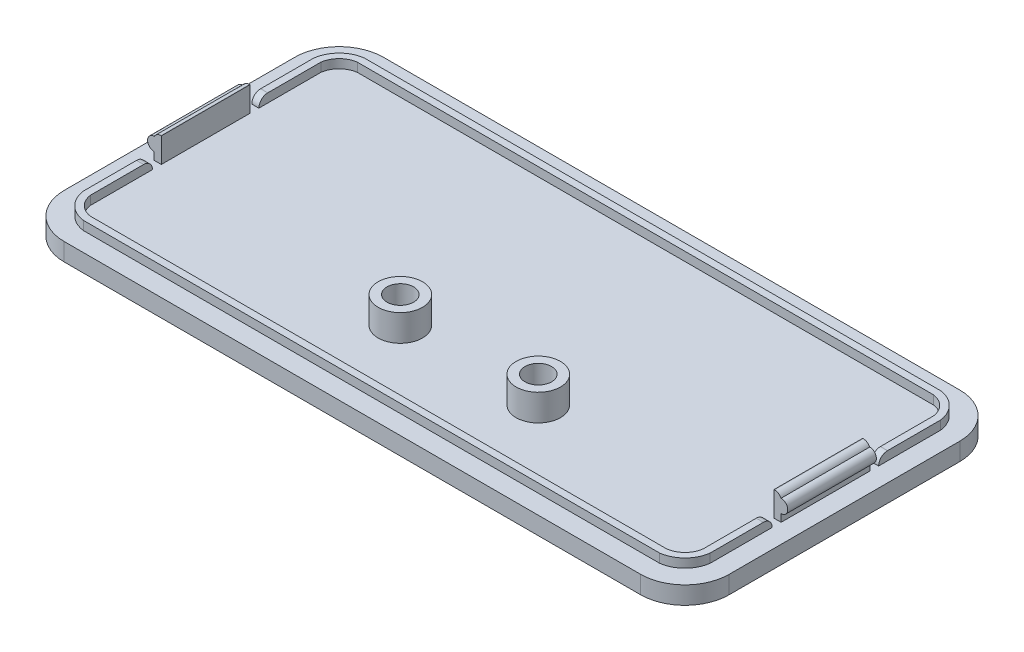
from build123d import *

# Parameters (mm, degrees)
EXTRUDE_2_DEPTH     = 2
EXTRUDE_4_DEPTH     = 1
SKETCH_7_W          = 0.8
SKETCH_7_H          = 10
EXTRUDE_8_DEPTH     = 2.8
SKETCH_8_R          = 0.75
EXTRUDE_9_DEPTH     = 10
FILLET_1_R          = 0.85
SKETCH_11_W         = 1
SKETCH_11_H         = 1
CUT_EXTRUDE_1_DEPTH = 1.2
FILLET_2_R          = 1
SKETCH3_W           = 1.794871795
SKETCH3_H           = 10.256410256
CUT_EXTRUDE1_DEPTH  = 1
SKETCH_13_W         = 0.8
SKETCH_13_H         = 10
EXTRUDE_10_DEPTH    = 1.8
SKETCH_14_R         = 0.75
EXTRUDE_11_DEPTH    = 10
FILLET_3_R          = 0.85
SKETCH_15_W         = 0.8
SKETCH_15_H         = 1
CUT_EXTRUDE_3_DEPTH = 1
FILLET_4_R          = 1
SKETCH2_R           = 2.5
SKETCH2_R_2         = 1.5
BOSS_EXTRUDE1_DEPTH = 3


# Some blends are built 0.0001 mm under size
with BuildPart() as part:
    # case 2 → 凸台-拉伸2 (new body)
    with BuildSketch(Plane(origin=(0, 0, 0), x_dir=(1, 0, 0), z_dir=(0, 1, 0))):
        with BuildLine():
            Line((-34.042196447, 18), (30.957803553, 18))
            ThreePointArc((30.957803553, 18), (34.493337459, 16.535533906), (35.957803553, 13))
            Line((35.957803553, 13), (35.957803553, -13))
            ThreePointArc((35.957803553, -13), (34.493337459, -16.535533906), (30.957803553, -18))
            Line((30.957803553, -18), (-34.042196447, -18))
            ThreePointArc((-34.042196447, -18), (-37.577730353, -16.535533906), (-39.042196447, -13))
            Line((-39.042196447, -13), (-39.042196447, 13))
            ThreePointArc((-39.042196447, 13), (-37.577730353, 16.535533906), (-34.042196447, 18))
        make_face()
    extrude(amount=EXTRUDE_2_DEPTH)

    # 草图3 → 凸台-拉伸4 (add)
    with BuildSketch(Plane(origin=(0, 2, 0), x_dir=(1, 0, 0), z_dir=(0, 1, 0))):
        with BuildLine():
            Line((-36.892196447, 13), (-36.892196447, -13))
            ThreePointArc((-36.892196447, -13), (-35.952846076, -14.910649629), (-34.042196447, -15.85))
            Line((-34.042196447, -15.85), (30.957803553, -15.85))
            ThreePointArc((30.957803553, -15.85), (32.868453181, -14.910649629), (33.807803553, -13))
            Line((33.807803553, -13), (33.807803553, 13))
            ThreePointArc((33.807803553, 13), (32.868453181, 14.910649629), (30.957803553, 15.85))
            Line((30.957803553, 15.85), (-34.042196447, 15.85))
            ThreePointArc((-34.042196447, 15.85), (-35.952846076, 14.910649629), (-36.892196447, 13))
        make_face()
        with BuildLine():
            Line((-34.042196447, -15.05), (30.957803553, -15.05))
            ThreePointArc((30.957803553, -15.05), (32.327315928, -14.369512375), (33.007803553, -13))
            Line((33.007803553, -13), (33.007803553, 13))
            ThreePointArc((33.007803553, 13), (32.327315928, 14.369512375), (30.957803553, 15.05))
            Line((30.957803553, 15.05), (-34.042196447, 15.05))
            ThreePointArc((-34.042196447, 15.05), (-35.411708823, 14.369512375), (-36.092196447, 13))
            Line((-36.092196447, 13), (-36.092196447, -13))
            ThreePointArc((-36.092196447, -13), (-35.411708823, -14.369512375), (-34.042196447, -15.05))
        make_face(mode=Mode.SUBTRACT)
    extrude(amount=EXTRUDE_4_DEPTH)

    # 草图7 → 凸台-拉伸8 (add)
    with BuildSketch(Plane(origin=(0, 2, 0), x_dir=(1, 0, 0), z_dir=(0, 1, 0))):
        with Locations((-36.492196447, 0)):
            Rectangle(SKETCH_7_W, SKETCH_7_H)
    extrude(amount=EXTRUDE_8_DEPTH)

    # 草图8 → 凸台-拉伸9 (add)
    with BuildSketch(Plane.XY.offset(5)):
        with Locations((-36.892196447, 3.6)):
            Circle(SKETCH_8_R)
    extrude(amount=-EXTRUDE_9_DEPTH)

    # 圆角1
    # the kernel refuses this fillet: 0.85 mm, written as the material it takes off along each edge
    with BuildSketch(Plane(origin=(-36.892196447, 4.8, 6.875), x_dir=(0, -1, 0), z_dir=(0, 0, -1))) as fillet_1_piece_1:
        with BuildLine():
            CenterArc((0.85, -0.75), FILLET_1_R, 118.072486936, 61.927513064)
            Line((0, -0.75), (-0.017, -0.75))
            Line((-0.017, -0.75), (-0.017, 0))
            Line((-0.017, 0), (0, 0.017))
            ThreePointArc((0, 0.017), (0.225, 0.017), (0.442, 0.015))
            Line((0.442, 0.015), (0.45, 0))
        make_face()
    extrude(amount=13.75, mode=Mode.SUBTRACT)

    # 草图11 → 切除-拉伸1 (cut)
    with BuildSketch(Plane.ZY.offset(36.892196447)):
        with Locations((5.5, 2.5)):
            Rectangle(SKETCH_11_W, SKETCH_11_H)
        with Locations((-5.5, 2.5)):
            Rectangle(SKETCH_11_W, SKETCH_11_H)
    extrude(amount=-CUT_EXTRUDE_1_DEPTH, mode=Mode.SUBTRACT)

    # 圆角2
    fillet_2_edges = [part.edges().sort_by_distance(p)[0] for p in [
        (-36.492196447, 3, 6),
        (-36.492196447, 3, -6),
    ]]
    fillet(fillet_2_edges, radius=FILLET_2_R - 0.0001)  # a hair under: the kernel refuses the full size

    # Sketch3 → Cut-Extrude1 (cut)
    # profile 1 of 9: a face of its own
    with BuildSketch(Plane.XZ):
        with BuildLine():
            Line((-34.346153846, 5.5), (-32.342948718, 5.5))
            add(Edge.make_bspline(
                [(-32.342948718, 5.5), (-32.212061894, 5.499414123), (-31.959553774, 5.498283843), (-31.59541629, 5.484577693), (-31.259481633, 5.460015438), (-30.951826982, 5.429660375), (-30.672578836, 5.387103759), (-30.421387495, 5.33831593), (-30.198200829, 5.278878154), (-30.000502078, 5.208326339), (-29.823073834, 5.125148505), (-29.65516949, 5.036558175), (-29.500583701, 4.93082874), (-29.351514057, 4.81935527), (-29.216483126, 4.691488748), (-29.08706687, 4.555738875), (-28.96874642, 4.406721924), (-28.860973524, 4.246241705), (-28.7632069, 4.077263206), (-28.677791437, 3.899484343), (-28.608507197, 3.7126238), (-28.550386335, 3.517890353), (-28.503703092, 3.315292488), (-28.47262924, 3.10358421), (-28.451522316, 2.884243747), (-28.449659922, 2.73496049), (-28.448717949, 2.659455128)],
                knots=[0, 0, 0, 0, 1.698747864, 3.27724071, 4.728299578, 6.070144658, 7.288476769, 8.393259625, 9.389771311, 10.283485332, 11.113357557, 11.931608583, 12.74405601, 13.541433047, 14.344816069, 15.154114104, 15.974336324, 16.810834471, 17.661136416, 18.50621059, 19.367396281, 20.244825668, 21.142564693, 22.063065223, 23.020325768, 24, 24, 24, 24], degree=3))
            add(Edge.make_bspline(
                [(-28.448717949, 2.659455128), (-28.450080866, 2.575925345), (-28.452759164, 2.411779055), (-28.479015125, 2.171160733), (-28.523868602, 1.941752949), (-28.58248975, 1.721621064), (-28.664232772, 1.514386738), (-28.757620336, 1.315105294), (-28.872516661, 1.129363974), (-29.003804081, 0.954839376), (-29.147184921, 0.790112534), (-29.306063036, 0.639939624), (-29.477410142, 0.503296922), (-29.660234371, 0.378752402), (-29.8552221, 0.266557297), (-30.062232636, 0.165661021), (-30.282679565, 0.079290548), (-30.436192173, 0.03411949), (-30.514022436, 0.011217949)],
                knots=[0, 0, 0, 0, 1.102006807, 2.165578795, 3.188629044, 4.184801286, 5.166646146, 6.124351954, 7.085497154, 8.042432466, 9.003981491, 9.963833307, 10.922997304, 11.89326795, 12.880200226, 13.889073926, 14.929769137, 16, 16, 16, 16], degree=3))
            add(Edge.make_bspline(
                [(-30.514022436, 0.011217949), (-30.565285924, -0.00153649), (-30.676339148, -0.029166712), (-30.86010173, -0.057218322), (-31.071868812, -0.083010053), (-31.312325176, -0.105174923), (-31.581609449, -0.12024187), (-31.879460895, -0.132008485), (-32.206014495, -0.14056403), (-32.433086955, -0.140867618), (-32.551282051, -0.141025641)],
                knots=[0, 0, 0, 0, 0.618981996, 1.340914327, 2.176866532, 3.120127938, 4.170906482, 5.338178032, 6.614476169, 8, 8, 8, 8], degree=3))
            Line((-32.551282051, -0.141025641), (-32.551282051, -4.5))
            Line((-32.551282051, -4.5), (-34.346153846, -4.5))
            Line((-34.346153846, -4.5), (-34.346153846, 5.5))
        make_face()
        with BuildLine():
            Line((-32.551282051, 1.653846154), (-31.916266026, 1.653846154))
            add(Edge.make_bspline(
                [(-31.916266026, 1.653846154), (-31.800714834, 1.654578838), (-31.588098926, 1.655926988), (-31.297740676, 1.675422019), (-31.064403201, 1.705194869), (-30.880062263, 1.747896022), (-30.734507633, 1.812700675), (-30.608975876, 1.887667455), (-30.501304084, 1.982460891), (-30.40807616, 2.090778611), (-30.333543244, 2.215241101), (-30.281858549, 2.353821729), (-30.248285187, 2.50360877), (-30.245184375, 2.607850636), (-30.243589744, 2.661458333)],
                knots=[0, 0, 0, 0, 1.8619151, 3.425951444, 4.686033666, 5.651700536, 6.461346321, 7.243864085, 7.999046032, 8.762387399, 9.539336099, 10.322741239, 11.137448474, 12, 12, 12, 12], degree=3))
            add(Edge.make_bspline(
                [(-30.243589744, 2.661458333), (-30.245167972, 2.708294681), (-30.248230115, 2.799168456), (-30.270725453, 2.930321853), (-30.306576549, 3.052583875), (-30.35852341, 3.164677657), (-30.425678401, 3.266412733), (-30.507553924, 3.357749027), (-30.603099357, 3.440642582), (-30.676866017, 3.484519408), (-30.714342949, 3.506810897)],
                knots=[0, 0, 0, 0, 1.102301479, 2.1387299, 3.123554645, 4.094223062, 5.036071848, 5.982632524, 6.975082478, 8, 8, 8, 8], degree=3))
            add(Edge.make_bspline(
                [(-30.714342949, 3.506810897), (-30.746088073, 3.522865317), (-30.813299006, 3.556855813), (-30.927765742, 3.59637225), (-31.059858607, 3.629708718), (-31.210469377, 3.657377665), (-31.378997222, 3.678851641), (-31.565412075, 3.69527386), (-31.769988262, 3.701877875), (-31.912258759, 3.704014878), (-31.986378205, 3.705128205)],
                knots=[0, 0, 0, 0, 0.656809284, 1.390599849, 2.23162475, 3.173112763, 4.218524733, 5.370385145, 6.63003504, 8, 8, 8, 8], degree=3))
            Line((-31.986378205, 3.705128205), (-32.551282051, 3.705128205))
            Line((-32.551282051, 3.705128205), (-32.551282051, 1.653846154))
        make_face(mode=Mode.SUBTRACT)
    # profile 2 of 9: a face of its own
    with BuildSketch(Plane.XZ):
        with BuildLine():
            Line((-19.608573718, -1.294871795), (-25.371794872, -1.294871795))
            add(Edge.make_bspline(
                [(-25.371794872, -1.294871795), (-25.360044129, -1.361837155), (-25.336952993, -1.493429371), (-25.28680977, -1.684578484), (-25.222819497, -1.864714181), (-25.146131184, -2.03407726), (-25.058037797, -2.193563078), (-24.955284158, -2.342423583), (-24.839173605, -2.480527291), (-24.710377458, -2.60727399), (-24.571042515, -2.72084178), (-24.421844499, -2.820334343), (-24.262629446, -2.901912158), (-24.095222698, -2.970673791), (-23.91837334, -3.025139971), (-23.731821096, -3.062704259), (-23.536060486, -3.084893621), (-23.402702378, -3.088103059), (-23.334535256, -3.08974359)],
                knots=[0, 0, 0, 0, 1.091296461, 2.144483647, 3.168565212, 4.157007626, 5.126487748, 6.090021542, 7.05641414, 8.019231907, 8.98705074, 9.938580405, 10.892824166, 11.854447369, 12.841318655, 13.858982407, 14.905600794, 16, 16, 16, 16], degree=3))
            add(Edge.make_bspline(
                [(-23.334535256, -3.08974359), (-23.252252913, -3.087571256), (-23.090214747, -3.083293292), (-22.852827627, -3.045354104), (-22.623239702, -2.988048629), (-22.403623683, -2.902830576), (-22.191435664, -2.796749081), (-21.99016891, -2.664584591), (-21.796339653, -2.510199384), (-21.678080964, -2.391199325), (-21.617788462, -2.330528846)],
                knots=[0, 0, 0, 0, 1.021034703, 2.010718019, 2.977989445, 3.954245119, 4.929443971, 5.918328161, 6.938689359, 8, 8, 8, 8], degree=3))
            Line((-21.617788462, -2.330528846), (-20.115384615, -3.045673077))
            add(Edge.make_bspline(
                [(-20.115384615, -3.045673077), (-20.162686924, -3.111037607), (-20.256414708, -3.24055502), (-20.40942217, -3.42281947), (-20.5690952, -3.592879596), (-20.735552881, -3.749616887), (-20.909006324, -3.892584703), (-21.088973023, -4.02352465), (-21.278083117, -4.138921045), (-21.472555384, -4.244356693), (-21.676409927, -4.334746186), (-21.889082589, -4.411827154), (-22.109672582, -4.481507694), (-22.340965482, -4.534600448), (-22.581035315, -4.576628239), (-22.830456374, -4.606473539), (-23.089195787, -4.62490755), (-23.265059458, -4.62709288), (-23.354567308, -4.628205128)],
                knots=[0, 0, 0, 0, 1.028154879, 2.037251081, 3.030720504, 4.000128189, 4.949298328, 5.894184978, 6.834267904, 7.770992897, 8.712077017, 9.673380525, 10.653304757, 11.658697181, 12.695551717, 13.758623199, 14.859225354, 16, 16, 16, 16], degree=3))
            add(Edge.make_bspline(
                [(-23.354567308, -4.628205128), (-23.492273665, -4.62539771), (-23.761963628, -4.619899543), (-24.156433952, -4.568868685), (-24.531071349, -4.484254021), (-24.886933665, -4.369233381), (-25.222482625, -4.217370103), (-25.537884295, -4.031628717), (-25.836289987, -3.815570256), (-26.108581741, -3.564660229), (-26.356647563, -3.291559581), (-26.574533157, -2.998268135), (-26.75685672, -2.686835006), (-26.906584497, -2.359321324), (-27.022958126, -2.014888783), (-27.106856762, -1.653387079), (-27.158287632, -1.274988873), (-27.163842421, -1.017257454), (-27.166666667, -0.886217949)],
                knots=[0, 0, 0, 0, 1.103565453, 2.161269334, 3.182010356, 4.179077853, 5.15417608, 6.128274628, 7.109042802, 8.101804412, 9.090965879, 10.063106201, 11.02526161, 11.978650795, 12.945248442, 13.93468508, 14.949922959, 16, 16, 16, 16], degree=3))
            add(Edge.make_bspline(
                [(-27.166666667, -0.886217949), (-27.163814625, -0.751848561), (-27.15820336, -0.487482826), (-27.107299582, -0.100347232), (-27.022726175, 0.269032487), (-26.906012127, 0.621165006), (-26.75855574, 0.957151645), (-26.573912422, 1.274052922), (-26.356755688, 1.572972117), (-26.109583518, 1.852510854), (-25.836138252, 2.104825104), (-25.545576822, 2.329687524), (-25.234634472, 2.517057818), (-24.90682823, 2.668452899), (-24.564254861, 2.791457581), (-24.202954696, 2.873306924), (-23.82567668, 2.928263858), (-23.567777735, 2.933325049), (-23.436698718, 2.935897436)],
                knots=[0, 0, 0, 0, 1.079208495, 2.12329425, 3.130605359, 4.119693003, 5.099659317, 6.073216462, 7.060498243, 8.06384408, 9.066070512, 10.045757761, 11.010926815, 11.975797609, 12.942977511, 13.929384301, 14.947594487, 16, 16, 16, 16], degree=3))
            add(Edge.make_bspline(
                [(-23.436698718, 2.935897436), (-23.298332654, 2.933046463), (-23.026665148, 2.92744887), (-22.62944746, 2.876832371), (-22.252322515, 2.791701737), (-21.893683551, 2.677675659), (-21.558110534, 2.521976156), (-21.238229907, 2.34080557), (-20.941714222, 2.120076842), (-20.665402937, 1.870394688), (-20.415975531, 1.593380991), (-20.197948342, 1.292459272), (-20.012434038, 0.970566352), (-19.862072854, 0.626396885), (-19.745818719, 0.260984102), (-19.661842419, -0.125197436), (-19.610803845, -0.533616578), (-19.605352417, -0.813284573), (-19.602564103, -0.956330128)],
                knots=[0, 0, 0, 0, 1.080001299, 2.120471247, 3.119684163, 4.095710327, 5.052285597, 6.002875087, 6.961153713, 7.931888285, 8.906493152, 9.865905668, 10.82813294, 11.801621613, 12.7925306, 13.817193356, 14.883530496, 16, 16, 16, 16], degree=3))
            Line((-19.602564103, -0.956330128), (-19.608573718, -1.294871795))
        make_face()
        with BuildLine():
            add(Edge.make_bspline(
                [(-21.397435897, 0.115384615), (-21.431306226, 0.206786912), (-21.498649262, 0.388518488), (-21.650774379, 0.639263719), (-21.852639541, 0.856419274), (-22.087423207, 1.048668808), (-22.355678245, 1.204710539), (-22.648951472, 1.31768982), (-22.963535969, 1.385433614), (-23.179953151, 1.393378771), (-23.290464744, 1.397435897)],
                knots=[0, 0, 0, 0, 0.954238005, 1.897273737, 2.851915805, 3.847685534, 4.862635127, 5.880135777, 6.917509367, 8, 8, 8, 8], degree=3))
            add(Edge.make_bspline(
                [(-23.290464744, 1.397435897), (-23.411161396, 1.393538533), (-23.64709822, 1.385919998), (-23.987421025, 1.304894075), (-24.308439011, 1.183965305), (-24.497693022, 1.059285175), (-24.592548077, 0.996794872)],
                knots=[0, 0, 0, 0, 1.044195649, 2.041185066, 3.018232172, 4, 4, 4, 4], degree=3))
            add(Edge.make_bspline(
                [(-24.592548077, 0.996794872), (-24.651730547, 0.949200888), (-24.777904548, 0.847732947), (-24.941767086, 0.645314038), (-25.10317305, 0.40023018), (-25.19494124, 0.214071675), (-25.243589744, 0.115384615)],
                knots=[0, 0, 0, 0, 0.82159062, 1.751589201, 2.808063854, 4, 4, 4, 4], degree=3))
            Line((-25.243589744, 0.115384615), (-21.397435897, 0.115384615))
        make_face(mode=Mode.SUBTRACT)
    # profile 3 of 9: a face of its own
    with BuildSketch(Plane.XZ):
        with BuildLine():
            Line((-12.551282051, 2.807692308), (-10.756410256, 2.807692308))
            Line((-10.756410256, 2.807692308), (-10.756410256, -4.5))
            Line((-10.756410256, -4.5), (-12.551282051, -4.5))
            Line((-12.551282051, -4.5), (-12.551282051, -3.702724359))
            add(Edge.make_bspline(
                [(-12.551282051, -3.702724359), (-12.640217287, -3.780330319), (-12.812823018, -3.930948161), (-13.084793797, -4.12637864), (-13.357559306, -4.287583528), (-13.632430191, -4.41597443), (-13.913631102, -4.510777897), (-14.203186573, -4.579417821), (-14.50526651, -4.619896463), (-14.71061629, -4.625406724), (-14.814903846, -4.628205128)],
                knots=[0, 0, 0, 0, 1.129196829, 2.191548051, 3.199897424, 4.157751732, 5.089409408, 6.034969131, 7.002052659, 8, 8, 8, 8], degree=3))
            add(Edge.make_bspline(
                [(-14.814903846, -4.628205128), (-14.931971264, -4.625571477), (-15.163303116, -4.620367234), (-15.502756926, -4.565584179), (-15.830533327, -4.481726502), (-16.146366257, -4.363057407), (-16.449681084, -4.209285525), (-16.742799088, -4.024422978), (-17.020695333, -3.801979986), (-17.28568321, -3.55158109), (-17.528304521, -3.276140523), (-17.740406361, -2.979481362), (-17.919192449, -2.665811062), (-18.065662324, -2.336169585), (-18.180879796, -1.990798869), (-18.263013366, -1.628603503), (-18.311472267, -1.24945413), (-18.317470113, -0.991192425), (-18.320512821, -0.860176282)],
                knots=[0, 0, 0, 0, 0.980476535, 1.937477201, 2.874147792, 3.812856188, 4.758993464, 5.720109578, 6.712210464, 7.737600662, 8.772720504, 9.783789959, 10.789002326, 11.793715968, 12.802552247, 13.835794126, 14.902098527, 16, 16, 16, 16], degree=3))
            add(Edge.make_bspline(
                [(-18.320512821, -0.860176282), (-18.317319488, -0.724508894), (-18.311055411, -0.458382195), (-18.265234059, -0.067853919), (-18.184616162, 0.303322052), (-18.074687865, 0.655659847), (-17.933284198, 0.989220339), (-17.761063981, 1.304550006), (-17.555684317, 1.600824627), (-17.319020664, 1.8730014), (-17.063482045, 2.122464558), (-16.790100899, 2.339642021), (-16.503152308, 2.524144381), (-16.202331338, 2.674769906), (-15.88768095, 2.791165689), (-15.560443377, 2.87626051), (-15.219165916, 2.927320392), (-14.986684944, 2.933014678), (-14.868990385, 2.935897436)],
                knots=[0, 0, 0, 0, 1.136281865, 2.228943489, 3.287578264, 4.313574083, 5.316051562, 6.317280042, 7.318008486, 8.329309503, 9.333984563, 10.305318864, 11.248632312, 12.186624717, 13.117503092, 14.05354244, 15.014596925, 16, 16, 16, 16], degree=3))
            add(Edge.make_bspline(
                [(-14.868990385, 2.935897436), (-14.759967087, 2.933632454), (-14.544249279, 2.929150872), (-14.227175182, 2.880489461), (-13.919659039, 2.806892533), (-13.623378367, 2.702030158), (-13.335902973, 2.569620077), (-13.062177614, 2.403700375), (-12.796214302, 2.211244585), (-12.633934865, 2.060932535), (-12.551282051, 1.984375)],
                knots=[0, 0, 0, 0, 1.017011718, 2.012299608, 2.98747302, 3.965332399, 4.941441765, 5.936729654, 6.94912688, 8, 8, 8, 8], degree=3))
            Line((-12.551282051, 1.984375), (-12.551282051, 2.807692308))
        make_face()
        with BuildLine():
            add(Edge.make_bspline(
                [(-14.492387821, 1.269230769), (-14.563908171, 1.267036278), (-14.704083387, 1.262735219), (-14.910230225, 1.236864046), (-15.107244762, 1.191277886), (-15.293721904, 1.123934125), (-15.472440845, 1.041899611), (-15.640687712, 0.939152733), (-15.799851096, 0.817708107), (-15.94899494, 0.680505905), (-16.084961529, 0.5296956), (-16.202172664, 0.365128882), (-16.301783193, 0.191239889), (-16.386027812, 0.007505796), (-16.446327845, -0.188247538), (-16.494085447, -0.393471754), (-16.518868551, -0.609843428), (-16.523360946, -0.757294026), (-16.525641026, -0.83213141)],
                knots=[0, 0, 0, 0, 1.04836806, 2.054732945, 3.03993516, 4.00574415, 4.955904794, 5.917688631, 6.888591924, 7.88601754, 8.884115178, 9.859153345, 10.841239365, 11.818093293, 12.814750328, 13.83810466, 14.90274714, 16, 16, 16, 16], degree=3))
            add(Edge.make_bspline(
                [(-16.525641026, -0.83213141), (-16.523395775, -0.907647613), (-16.518971534, -1.056451413), (-16.493684728, -1.27464826), (-16.447645642, -1.482870319), (-16.380476352, -1.679434257), (-16.298447068, -1.866992373), (-16.198598981, -2.044679067), (-16.075953096, -2.209352616), (-15.939867317, -2.364909751), (-15.787663811, -2.503816234), (-15.627599816, -2.627152439), (-15.457488986, -2.730347762), (-15.279176903, -2.813750875), (-15.093263774, -2.881717402), (-14.897418811, -2.926730636), (-14.693560564, -2.955506745), (-14.554585013, -2.959514006), (-14.484375, -2.961538462)],
                knots=[0, 0, 0, 0, 1.099136573, 2.165835871, 3.191374663, 4.196217796, 5.183857741, 6.167377911, 7.154730987, 8.166690795, 9.170734848, 10.148332609, 11.103258353, 12.059567475, 13.009337315, 13.978056681, 14.978520572, 16, 16, 16, 16], degree=3))
            add(Edge.make_bspline(
                [(-14.484375, -2.961538462), (-14.4115225, -2.959331668), (-14.268691995, -2.955005152), (-14.059181975, -2.929370081), (-13.859520827, -2.883616776), (-13.670539249, -2.815887456), (-13.489350726, -2.734441788), (-13.317590322, -2.633702663), (-13.157121897, -2.512536719), (-13.007132751, -2.374094205), (-12.869696613, -2.222052443), (-12.75086454, -2.055327693), (-12.647357458, -1.879252272), (-12.565953899, -1.689663113), (-12.501308058, -1.489877143), (-12.454926159, -1.278654447), (-12.429697094, -1.055767301), (-12.425311548, -0.903638139), (-12.423076923, -0.826121795)],
                knots=[0, 0, 0, 0, 1.050008698, 2.058587853, 3.036635738, 3.995319155, 4.947022481, 5.895997462, 6.858296291, 7.838991643, 8.833936038, 9.806048392, 10.784806122, 11.771666913, 12.772873988, 13.80724452, 14.882696879, 16, 16, 16, 16], degree=3))
            add(Edge.make_bspline(
                [(-12.423076923, -0.826121795), (-12.42528378, -0.749938696), (-12.429594413, -0.601130972), (-12.455034965, -0.382897604), (-12.50174615, -0.175822357), (-12.565061473, 0.020475401), (-12.647913225, 0.205546837), (-12.751498624, 0.37733995), (-12.869027177, 0.541806728), (-13.007984932, 0.689741001), (-13.157161552, 0.827181084), (-13.319989926, 0.944682882), (-13.491340075, 1.045949192), (-13.672264778, 1.129092738), (-13.864439315, 1.190040109), (-14.064441671, 1.237229428), (-14.275392296, 1.262719691), (-14.418875606, 1.267024992), (-14.492387821, 1.269230769)],
                knots=[0, 0, 0, 0, 1.106611376, 2.161533483, 3.185006901, 4.184773755, 5.152708835, 6.122342771, 7.094156588, 8.082475533, 9.064254463, 10.03606828, 10.992420271, 11.951521816, 12.920622147, 13.915721683, 14.932141191, 16, 16, 16, 16], degree=3))
        make_face(mode=Mode.SUBTRACT)
    # profile 4 of 9: a face of its own
    with BuildSketch(Plane.XZ):
        Polygon((-8.961538462, 5.756410256), (-7.166666667, 5.756410256), (-7.166666667, -0.225160256), (-4.374198718, 2.807692308), (-2.156650641, 2.807692308), (-5.363782051, -0.67588141), (-1.697916667, -4.5), (-3.957532051, -4.5), (-7.166666667, -1.152644231), (-7.166666667, -4.5), (-8.961538462, -4.5), align=None)
    # profile 5 of 9: a face of its own
    with BuildSketch(Plane.XZ):
        with BuildLine():
            Line((-0.628205128, 5.5), (1.375, 5.5))
            add(Edge.make_bspline(
                [(1.375, 5.5), (1.505886824, 5.499414123), (1.758394944, 5.498283843), (2.122532428, 5.484577693), (2.458467085, 5.460015438), (2.766121736, 5.429660375), (3.045369882, 5.387103759), (3.296561223, 5.33831593), (3.519747889, 5.278878154), (3.71744664, 5.208326339), (3.894874884, 5.125148505), (4.062779228, 5.036558175), (4.217365017, 4.93082874), (4.366434661, 4.81935527), (4.501465592, 4.691488748), (4.630881848, 4.555738875), (4.749202298, 4.406721924), (4.856975194, 4.246241705), (4.954741818, 4.077263206), (5.04015728, 3.899484343), (5.10944152, 3.7126238), (5.167562383, 3.517890353), (5.214245625, 3.315292488), (5.245319478, 3.10358421), (5.266426402, 2.884243747), (5.268288796, 2.73496049), (5.269230769, 2.659455128)],
                knots=[0, 0, 0, 0, 1.698747864, 3.27724071, 4.728299578, 6.070144658, 7.288476769, 8.393259625, 9.389771311, 10.283485332, 11.113357557, 11.931608583, 12.74405601, 13.541433047, 14.344816069, 15.154114104, 15.974336324, 16.810834471, 17.661136416, 18.50621059, 19.367396281, 20.244825668, 21.142564693, 22.063065223, 23.020325768, 24, 24, 24, 24], degree=3))
            add(Edge.make_bspline(
                [(5.269230769, 2.659455128), (5.267867852, 2.575925345), (5.265189553, 2.411779055), (5.238933593, 2.171160733), (5.194080116, 1.941752949), (5.135458968, 1.721621064), (5.053715946, 1.514386738), (4.960328382, 1.315105294), (4.845432057, 1.129363974), (4.714144637, 0.954839376), (4.570763797, 0.790112534), (4.411885682, 0.639939624), (4.240538576, 0.503296922), (4.057714347, 0.378752402), (3.862726618, 0.266557297), (3.655716082, 0.165661021), (3.435269153, 0.079290548), (3.281756545, 0.03411949), (3.203926282, 0.011217949)],
                knots=[0, 0, 0, 0, 1.102006807, 2.165578795, 3.188629044, 4.184801286, 5.166646146, 6.124351954, 7.085497154, 8.042432466, 9.003981491, 9.963833307, 10.922997304, 11.89326795, 12.880200226, 13.889073926, 14.929769137, 16, 16, 16, 16], degree=3))
            add(Edge.make_bspline(
                [(3.203926282, 0.011217949), (3.152662794, -0.00153649), (3.04160957, -0.029166712), (2.857846988, -0.057218322), (2.646079906, -0.083010053), (2.405623542, -0.105174923), (2.136339269, -0.12024187), (1.838487823, -0.132008485), (1.511934223, -0.14056403), (1.284861763, -0.140867618), (1.166666667, -0.141025641)],
                knots=[0, 0, 0, 0, 0.618981996, 1.340914327, 2.176866532, 3.120127938, 4.170906482, 5.338178032, 6.614476169, 8, 8, 8, 8], degree=3))
            Line((1.166666667, -0.141025641), (1.166666667, -4.5))
            Line((1.166666667, -4.5), (-0.628205128, -4.5))
            Line((-0.628205128, -4.5), (-0.628205128, 5.5))
        make_face()
        with BuildLine():
            Line((1.166666667, 1.653846154), (1.801682692, 1.653846154))
            add(Edge.make_bspline(
                [(1.801682692, 1.653846154), (1.917233884, 1.654578838), (2.129849792, 1.655926988), (2.420208042, 1.675422019), (2.653545517, 1.705194869), (2.837886455, 1.747896022), (2.983441085, 1.812700675), (3.108972842, 1.887667455), (3.216644634, 1.982460891), (3.309872558, 2.090778611), (3.384405474, 2.215241101), (3.436090169, 2.353821729), (3.469663531, 2.50360877), (3.472764343, 2.607850636), (3.474358974, 2.661458333)],
                knots=[0, 0, 0, 0, 1.8619151, 3.425951444, 4.686033666, 5.651700536, 6.461346321, 7.243864085, 7.999046032, 8.762387399, 9.539336099, 10.322741239, 11.137448474, 12, 12, 12, 12], degree=3))
            add(Edge.make_bspline(
                [(3.474358974, 2.661458333), (3.472780746, 2.708294681), (3.469718603, 2.799168456), (3.447223265, 2.930321853), (3.411372169, 3.052583875), (3.359425308, 3.164677657), (3.292270317, 3.266412733), (3.210394794, 3.357749027), (3.114849361, 3.440642582), (3.041082701, 3.484519408), (3.003605769, 3.506810897)],
                knots=[0, 0, 0, 0, 1.102301479, 2.1387299, 3.123554645, 4.094223062, 5.036071848, 5.982632524, 6.975082478, 8, 8, 8, 8], degree=3))
            add(Edge.make_bspline(
                [(3.003605769, 3.506810897), (2.971860645, 3.522865317), (2.904649712, 3.556855813), (2.790182976, 3.59637225), (2.658090111, 3.629708718), (2.507479341, 3.657377665), (2.338951496, 3.678851641), (2.152536643, 3.69527386), (1.947960456, 3.701877875), (1.805689959, 3.704014878), (1.731570513, 3.705128205)],
                knots=[0, 0, 0, 0, 0.656809284, 1.390599849, 2.23162475, 3.173112763, 4.218524733, 5.370385145, 6.63003504, 8, 8, 8, 8], degree=3))
            Line((1.731570513, 3.705128205), (1.166666667, 3.705128205))
            Line((1.166666667, 3.705128205), (1.166666667, 1.653846154))
        make_face(mode=Mode.SUBTRACT)
    # profile 6 of 9: a face of its own
    with BuildSketch(Plane.XZ):
        with BuildLine():
            Line((6.807692308, 2.807692308), (8.602564103, 2.807692308))
            Line((8.602564103, 2.807692308), (8.602564103, -0.699919872))
            add(Edge.make_bspline(
                [(8.602564103, -0.699919872), (8.602723488, -0.782059682), (8.603029388, -0.939706038), (8.611541581, -1.166117068), (8.62348587, -1.373159588), (8.638391535, -1.561077737), (8.660639195, -1.729419511), (8.686323181, -1.877863541), (8.715440535, -2.007479383), (8.76278903, -2.15195352), (8.836866605, -2.310052677), (8.948736856, -2.477893498), (9.084244359, -2.623026732), (9.241558317, -2.746740361), (9.422285292, -2.844229418), (9.623935339, -2.910296264), (9.843971289, -2.954700053), (9.997226, -2.959198917), (10.076923077, -2.961538462)],
                knots=[0, 0, 0, 0, 1.267339619, 2.432334223, 3.495366327, 4.467371443, 5.340232306, 6.114347373, 6.791623365, 7.387877112, 8.457231658, 9.474542289, 10.487879852, 11.508108106, 12.54995813, 13.638205937, 14.771795776, 16, 16, 16, 16], degree=3))
            add(Edge.make_bspline(
                [(10.076923077, -2.961538462), (10.15654943, -2.958868202), (10.310200482, -2.953715534), (10.531700417, -2.913533658), (10.733825429, -2.844680674), (10.91865147, -2.751289728), (11.08072801, -2.626301853), (11.221841424, -2.477369934), (11.340655608, -2.302091514), (11.397751302, -2.171338836), (11.427083333, -2.104166667)],
                knots=[0, 0, 0, 0, 1.116871431, 2.155171802, 3.144773418, 4.104381479, 5.046960687, 6.001340237, 6.973219418, 8, 8, 8, 8], degree=3))
            add(Edge.make_bspline(
                [(11.427083333, -2.104166667), (11.437847203, -2.074328187), (11.461607205, -2.008463184), (11.482754076, -1.89483699), (11.505514407, -1.760833291), (11.523518637, -1.603721206), (11.533706066, -1.424473744), (11.544620853, -1.222864992), (11.550183224, -0.99909574), (11.55090456, -0.842149572), (11.551282051, -0.760016026)],
                knots=[0, 0, 0, 0, 0.56094539, 1.238222264, 2.041156151, 2.969685991, 4.036367568, 5.220421584, 6.545382566, 8, 8, 8, 8], degree=3))
            Line((11.551282051, -0.760016026), (11.551282051, 2.807692308))
            Line((11.551282051, 2.807692308), (13.346153846, 2.807692308))
            Line((13.346153846, 2.807692308), (13.346153846, -0.263221154))
            add(Edge.make_bspline(
                [(13.346153846, -0.263221154), (13.345843066, -0.415483556), (13.345247206, -0.707416665), (13.328170227, -1.126185223), (13.304602061, -1.506929426), (13.274250797, -1.850697582), (13.230518376, -2.157632359), (13.176834499, -2.427013985), (13.117442991, -2.66062257), (13.062978765, -2.799037271), (13.037660256, -2.86338141)],
                knots=[0, 0, 0, 0, 1.388070971, 2.661352173, 3.82033814, 4.865898334, 5.806910977, 6.645039373, 7.370126333, 8, 8, 8, 8], degree=3))
            add(Edge.make_bspline(
                [(13.037660256, -2.86338141), (13.00520845, -2.932635584), (12.941151372, -3.069337373), (12.830000433, -3.263697042), (12.710173496, -3.447837431), (12.575969148, -3.617424055), (12.430126916, -3.77418049), (12.276769302, -3.921670191), (12.108989876, -4.053887155), (11.931139777, -4.174233696), (11.740737356, -4.281064307), (11.539086728, -4.375734322), (11.324008739, -4.452779482), (11.097368369, -4.518086121), (10.858120955, -4.566788641), (10.606748434, -4.603677085), (10.342975108, -4.622741173), (10.163086586, -4.626353967), (10.070913462, -4.628205128)],
                knots=[0, 0, 0, 0, 0.997311338, 1.968606903, 2.91805772, 3.860812155, 4.785445165, 5.709667791, 6.633356648, 7.568312411, 8.508286151, 9.478643871, 10.470653671, 11.485274776, 12.552984541, 13.653035246, 14.797438149, 16, 16, 16, 16], degree=3))
            add(Edge.make_bspline(
                [(10.070913462, -4.628205128), (9.971340586, -4.627018482), (9.776510234, -4.624696619), (9.491865812, -4.596262887), (9.22059585, -4.559473336), (8.965729062, -4.496924355), (8.723706114, -4.424458232), (8.497305566, -4.331972183), (8.28560229, -4.223234794), (8.088179729, -4.098890722), (7.906569021, -3.957800483), (7.736731851, -3.806062844), (7.58415129, -3.637640644), (7.443846205, -3.457734827), (7.317382479, -3.264689631), (7.204697345, -3.059191468), (7.105695351, -2.840305627), (7.052872876, -2.686897906), (7.026041667, -2.608974359)],
                knots=[0, 0, 0, 0, 1.211240017, 2.369985978, 3.478996442, 4.539426614, 5.559871561, 6.551301256, 7.510778031, 8.453136967, 9.386094087, 10.30661716, 11.221130616, 12.147659962, 13.080758632, 14.026335491, 14.997475882, 16, 16, 16, 16], degree=3))
            add(Edge.make_bspline(
                [(7.026041667, -2.608974359), (7.007736541, -2.548455949), (6.968303033, -2.418085187), (6.925726927, -2.201424197), (6.891673008, -1.951710275), (6.858546433, -1.668697792), (6.835436729, -1.351912277), (6.820331952, -1.001856828), (6.810126121, -0.617846912), (6.808527479, -0.350701513), (6.807692308, -0.211137821)],
                knots=[0, 0, 0, 0, 0.627914866, 1.352675004, 2.190563461, 3.132055958, 4.183353232, 5.345633452, 6.613289997, 8, 8, 8, 8], degree=3))
            Line((6.807692308, -0.211137821), (6.807692308, 2.807692308))
        make_face()
    # profile 7 of 9: a face of its own
    with BuildSketch(Plane.XZ):
        with Locations((15.910256411, 0.628205128)):
            Rectangle(SKETCH3_W, SKETCH3_H)
    # profile 8 of 9: a face of its own
    with BuildSketch(Plane.XZ):
        with BuildLine():
            Line((22.961538462, 1.679887821), (21.863782051, 0.5))
            add(Edge.make_bspline(
                [(21.863782051, 0.5), (21.808965815, 0.560657138), (21.704123119, 0.676671265), (21.543619085, 0.834824449), (21.385505268, 0.966519333), (21.232728109, 1.077148523), (21.082167351, 1.161987888), (20.935074493, 1.223027911), (20.79137896, 1.261777025), (20.696131487, 1.266792952), (20.649839744, 1.269230769)],
                knots=[0, 0, 0, 0, 1.327646587, 2.539285, 3.655602211, 4.666613517, 5.598770349, 6.454635452, 7.248928967, 8, 8, 8, 8], degree=3))
            add(Edge.make_bspline(
                [(20.649839744, 1.269230769), (20.602997149, 1.267803167), (20.513308154, 1.265069754), (20.386736883, 1.241623923), (20.275535554, 1.201034869), (20.181439535, 1.145708205), (20.105841127, 1.077551438), (20.052911157, 0.999581704), (20.017368195, 0.914224046), (20.014361491, 0.853591204), (20.012820513, 0.822516026)],
                knots=[0, 0, 0, 0, 1.295068245, 2.479652818, 3.543291146, 4.55379989, 5.481948265, 6.332409746, 7.145336708, 8, 8, 8, 8], degree=3))
            add(Edge.make_bspline(
                [(20.012820513, 0.822516026), (20.018041488, 0.775423699), (20.028874404, 0.677712593), (20.103281515, 0.564382288), (20.201727496, 0.480780842), (20.315207247, 0.402984895), (20.468888208, 0.316000698), (20.585474485, 0.256440077), (20.649839744, 0.223557692)],
                knots=[0, 0, 0, 0, 0.916701701, 1.902049539, 2.5493345, 3.440293453, 4.586830489, 6, 6, 6, 6], degree=3))
            Line((20.649839744, 0.223557692), (21.298878205, -0.104967949))
            add(Edge.make_bspline(
                [(21.298878205, -0.104967949), (21.381448307, -0.146894364), (21.541649816, -0.228239486), (21.766878129, -0.359500764), (21.97490259, -0.486728621), (22.161550288, -0.61711999), (22.327963628, -0.748409536), (22.472960584, -0.881895539), (22.600058062, -1.013346242), (22.741789591, -1.189585697), (22.883563657, -1.424322312), (23.001759197, -1.729586341), (23.077131055, -2.056456996), (23.085470083, -2.28269664), (23.08974359, -2.398637821)],
                knots=[0, 0, 0, 0, 1.076693506, 2.088987655, 3.030641824, 3.911722491, 4.735175175, 5.493635918, 6.202154166, 6.859459289, 8.120623445, 9.372284821, 10.653373066, 12, 12, 12, 12], degree=3))
            add(Edge.make_bspline(
                [(23.08974359, -2.398637821), (23.087168774, -2.476856671), (23.082129177, -2.629951718), (23.050269907, -2.855293033), (22.993042408, -3.069559258), (22.917731106, -3.276090379), (22.816289038, -3.471151681), (22.693133398, -3.655688756), (22.550208858, -3.832124473), (22.383737003, -3.994423313), (22.201369869, -4.145684056), (21.998638024, -4.272905202), (21.784505389, -4.38476183), (21.553314918, -4.472111898), (21.308310502, -4.542929594), (21.047391946, -4.592004483), (20.771444601, -4.622888568), (20.582484198, -4.626402849), (20.485576923, -4.628205128)],
                knots=[0, 0, 0, 0, 0.976600749, 1.911466839, 2.833459288, 3.740827163, 4.650527853, 5.570709661, 6.506801416, 7.479409329, 8.468875524, 9.458587492, 10.461481786, 11.480119772, 12.538142914, 13.641687514, 14.790552763, 16, 16, 16, 16], degree=3))
            add(Edge.make_bspline(
                [(20.485576923, -4.628205128), (20.357183106, -4.624116499), (20.105157347, -4.616090878), (19.737091973, -4.560185555), (19.389540545, -4.463412498), (19.062217125, -4.327845824), (18.753116903, -4.155096718), (18.466654177, -3.940752892), (18.197862854, -3.690398909), (18.04147727, -3.498389062), (17.961538462, -3.400240385)],
                knots=[0, 0, 0, 0, 1.056901255, 2.07460411, 3.05625841, 4.019970729, 4.984811261, 5.963335951, 6.958928997, 8, 8, 8, 8], degree=3))
            Line((17.961538462, -3.400240385), (19.049278846, -2.192307692))
            add(Edge.make_bspline(
                [(19.049278846, -2.192307692), (19.102277231, -2.248207359), (19.207496358, -2.359186481), (19.384853288, -2.505527457), (19.57250948, -2.63890649), (19.772553997, -2.750901359), (19.972638936, -2.841332177), (20.164603927, -2.90916794), (20.344831176, -2.951798137), (20.462010288, -2.958403358), (20.517628205, -2.961538462)],
                knots=[0, 0, 0, 0, 1.087861918, 2.159761696, 3.243809206, 4.338405912, 5.394481878, 6.343674753, 7.213841449, 8, 8, 8, 8], degree=3))
            add(Edge.make_bspline(
                [(20.517628205, -2.961538462), (20.573216017, -2.959928601), (20.680071133, -2.956834006), (20.831939922, -2.924644137), (20.966548228, -2.870528212), (21.080701082, -2.795495109), (21.175650373, -2.709368566), (21.242552516, -2.611485245), (21.286791755, -2.507691668), (21.292168516, -2.43512315), (21.294871795, -2.398637821)],
                knots=[0, 0, 0, 0, 1.255011871, 2.412479185, 3.488767498, 4.514443302, 5.48617286, 6.365347346, 7.178144445, 8, 8, 8, 8], degree=3))
            add(Edge.make_bspline(
                [(21.294871795, -2.398637821), (21.292459669, -2.364279202), (21.287507109, -2.293734335), (21.248297535, -2.189605064), (21.186737731, -2.086500378), (21.101357643, -1.984129577), (20.991021179, -1.88332328), (20.856123205, -1.784888911), (20.699775822, -1.683574877), (20.584288746, -1.623103965), (20.523637821, -1.591346154)],
                knots=[0, 0, 0, 0, 0.704666567, 1.446816302, 2.258757648, 3.165368109, 4.175243826, 5.322435858, 6.59381024, 8, 8, 8, 8], degree=3))
            Line((20.523637821, -1.591346154), (19.928685897, -1.290865385))
            add(Edge.make_bspline(
                [(19.928685897, -1.290865385), (19.793727051, -1.218495052), (19.534656666, -1.079571148), (19.184490352, -0.841346175), (18.88812512, -0.587750951), (18.645319454, -0.320147875), (18.45185142, -0.039287906), (18.316894485, 0.258404853), (18.231994247, 0.570108207), (18.222653862, 0.783254342), (18.217948718, 0.890625)],
                knots=[0, 0, 0, 0, 1.255999728, 2.41104856, 3.467751088, 4.449286722, 5.368722015, 6.253902015, 7.120417131, 8, 8, 8, 8], degree=3))
            add(Edge.make_bspline(
                [(18.217948718, 0.890625), (18.219580423, 0.960212569), (18.222783724, 1.096824272), (18.256884793, 1.297448026), (18.30840419, 1.490298455), (18.381103609, 1.675681824), (18.474230295, 1.853782082), (18.588326643, 2.023808835), (18.724784616, 2.185452973), (18.879235621, 2.338193804), (19.050603858, 2.477301454), (19.233993076, 2.600583362), (19.428860844, 2.705596623), (19.636806415, 2.789320665), (19.855186688, 2.855959792), (20.085443206, 2.901256317), (20.326593589, 2.930065065), (20.491501992, 2.933925766), (20.575721154, 2.935897436)],
                knots=[0, 0, 0, 0, 0.959035663, 1.882742823, 2.798841253, 3.708806893, 4.623422363, 5.566085165, 6.527241613, 7.536786942, 8.55815439, 9.567237405, 10.580975912, 11.605536372, 12.654523293, 13.725718749, 14.838518481, 16, 16, 16, 16], degree=3))
            add(Edge.make_bspline(
                [(20.575721154, 2.935897436), (20.69215469, 2.932063964), (20.92325472, 2.924455197), (21.264081813, 2.862885015), (21.593285432, 2.759399749), (21.909942665, 2.616814358), (22.209980311, 2.437625044), (22.486800398, 2.220028699), (22.742276348, 1.969383529), (22.887725318, 1.777344641), (22.961538462, 1.679887821)],
                knots=[0, 0, 0, 0, 0.996590028, 1.978055413, 2.954661574, 3.945146934, 4.945404762, 5.939399542, 6.954276554, 8, 8, 8, 8], degree=3))
        make_face()
    # profile 9 of 9: a face of its own
    with BuildSketch(Plane.XZ):
        with BuildLine():
            Line((31.929887821, -1.294871795), (26.166666667, -1.294871795))
            add(Edge.make_bspline(
                [(26.166666667, -1.294871795), (26.178417409, -1.361837155), (26.201508545, -1.493429371), (26.251651769, -1.684578484), (26.315642042, -1.864714181), (26.392330354, -2.03407726), (26.480423742, -2.193563078), (26.583177381, -2.342423583), (26.699287933, -2.480527291), (26.82808408, -2.60727399), (26.967419023, -2.72084178), (27.11661704, -2.820334343), (27.275832092, -2.901912158), (27.443238841, -2.970673791), (27.620088198, -3.025139971), (27.806640443, -3.062704259), (28.002401052, -3.084893621), (28.13575916, -3.088103059), (28.203926282, -3.08974359)],
                knots=[0, 0, 0, 0, 1.091296461, 2.144483647, 3.168565212, 4.157007626, 5.126487748, 6.090021542, 7.05641414, 8.019231907, 8.98705074, 9.938580405, 10.892824166, 11.854447369, 12.841318655, 13.858982407, 14.905600794, 16, 16, 16, 16], degree=3))
            add(Edge.make_bspline(
                [(28.203926282, -3.08974359), (28.286208626, -3.087571256), (28.448246792, -3.083293292), (28.685633912, -3.045354104), (28.915221837, -2.988048629), (29.134837855, -2.902830576), (29.347025874, -2.796749081), (29.548292628, -2.664584591), (29.742121885, -2.510199384), (29.860380574, -2.391199325), (29.920673077, -2.330528846)],
                knots=[0, 0, 0, 0, 1.021034703, 2.010718019, 2.977989445, 3.954245119, 4.929443971, 5.918328161, 6.938689359, 8, 8, 8, 8], degree=3))
            Line((29.920673077, -2.330528846), (31.423076923, -3.045673077))
            add(Edge.make_bspline(
                [(31.423076923, -3.045673077), (31.375774615, -3.111037607), (31.282046831, -3.24055502), (31.129039368, -3.42281947), (30.969366338, -3.592879596), (30.802908657, -3.749616887), (30.629455214, -3.892584703), (30.449488516, -4.02352465), (30.260378422, -4.138921045), (30.065906154, -4.244356693), (29.862051611, -4.334746186), (29.64937895, -4.411827154), (29.428788956, -4.481507694), (29.197496056, -4.534600448), (28.957426224, -4.576628239), (28.708005165, -4.606473539), (28.449265752, -4.62490755), (28.27340208, -4.62709288), (28.183894231, -4.628205128)],
                knots=[0, 0, 0, 0, 1.028154879, 2.037251081, 3.030720504, 4.000128189, 4.949298328, 5.894184978, 6.834267904, 7.770992897, 8.712077017, 9.673380525, 10.653304757, 11.658697181, 12.695551717, 13.758623199, 14.859225354, 16, 16, 16, 16], degree=3))
            add(Edge.make_bspline(
                [(28.183894231, -4.628205128), (28.046187874, -4.62539771), (27.776497911, -4.619899543), (27.382027587, -4.568868685), (27.00739019, -4.484254021), (26.651527874, -4.369233381), (26.315978913, -4.217370103), (26.000577244, -4.031628717), (25.702171552, -3.815570256), (25.429879797, -3.564660229), (25.181813975, -3.291559581), (24.963928381, -2.998268135), (24.781604818, -2.686835006), (24.631877042, -2.359321324), (24.515503413, -2.014888783), (24.431604776, -1.653387079), (24.380173907, -1.274988873), (24.374619117, -1.017257454), (24.371794872, -0.886217949)],
                knots=[0, 0, 0, 0, 1.103565453, 2.161269334, 3.182010356, 4.179077853, 5.15417608, 6.128274628, 7.109042802, 8.101804412, 9.090965879, 10.063106201, 11.02526161, 11.978650795, 12.945248442, 13.93468508, 14.949922959, 16, 16, 16, 16], degree=3))
            add(Edge.make_bspline(
                [(24.371794872, -0.886217949), (24.374646914, -0.751848561), (24.380258179, -0.487482826), (24.431161957, -0.100347232), (24.515735364, 0.269032487), (24.632449411, 0.621165006), (24.779905799, 0.957151645), (24.964549116, 1.274052922), (25.18170585, 1.572972117), (25.42887802, 1.852510854), (25.702323287, 2.104825104), (25.992884717, 2.329687524), (26.303827066, 2.517057818), (26.631633309, 2.668452899), (26.974206678, 2.791457581), (27.335506842, 2.873306924), (27.712784859, 2.928263858), (27.970683803, 2.933325049), (28.101762821, 2.935897436)],
                knots=[0, 0, 0, 0, 1.079208495, 2.12329425, 3.130605359, 4.119693003, 5.099659317, 6.073216462, 7.060498243, 8.06384408, 9.066070512, 10.045757761, 11.010926815, 11.975797609, 12.942977511, 13.929384301, 14.947594487, 16, 16, 16, 16], degree=3))
            add(Edge.make_bspline(
                [(28.101762821, 2.935897436), (28.240128884, 2.933046463), (28.511796391, 2.92744887), (28.909014079, 2.876832371), (29.286139023, 2.791701737), (29.644777987, 2.677675659), (29.980351004, 2.521976156), (30.300231631, 2.34080557), (30.596747317, 2.120076842), (30.873058602, 1.870394688), (31.122486007, 1.593380991), (31.340513196, 1.292459272), (31.5260275, 0.970566352), (31.676388685, 0.626396885), (31.79264282, 0.260984102), (31.876619119, -0.125197436), (31.927657694, -0.533616578), (31.933109121, -0.813284573), (31.935897436, -0.956330128)],
                knots=[0, 0, 0, 0, 1.080001299, 2.120471247, 3.119684163, 4.095710327, 5.052285597, 6.002875087, 6.961153713, 7.931888285, 8.906493152, 9.865905668, 10.82813294, 11.801621613, 12.7925306, 13.817193356, 14.883530496, 16, 16, 16, 16], degree=3))
            Line((31.935897436, -0.956330128), (31.929887821, -1.294871795))
        make_face()
        with BuildLine():
            add(Edge.make_bspline(
                [(30.141025641, 0.115384615), (30.107155313, 0.206786912), (30.039812276, 0.388518488), (29.88768716, 0.639263719), (29.685821997, 0.856419274), (29.451038332, 1.048668808), (29.182783293, 1.204710539), (28.889510066, 1.31768982), (28.57492557, 1.385433614), (28.358508388, 1.393378771), (28.247996795, 1.397435897)],
                knots=[0, 0, 0, 0, 0.954238005, 1.897273737, 2.851915805, 3.847685534, 4.862635127, 5.880135777, 6.917509367, 8, 8, 8, 8], degree=3))
            add(Edge.make_bspline(
                [(28.247996795, 1.397435897), (28.127300142, 1.393538533), (27.891363318, 1.385919998), (27.551040513, 1.304894075), (27.230022527, 1.183965305), (27.040768517, 1.059285175), (26.945913462, 0.996794872)],
                knots=[0, 0, 0, 0, 1.044195649, 2.041185066, 3.018232172, 4, 4, 4, 4], degree=3))
            add(Edge.make_bspline(
                [(26.945913462, 0.996794872), (26.886730991, 0.949200888), (26.76055699, 0.847732947), (26.596694452, 0.645314038), (26.435288488, 0.40023018), (26.343520299, 0.214071675), (26.294871795, 0.115384615)],
                knots=[0, 0, 0, 0, 0.82159062, 1.751589201, 2.808063854, 4, 4, 4, 4], degree=3))
            Line((26.294871795, 0.115384615), (30.141025641, 0.115384615))
        make_face(mode=Mode.SUBTRACT)
    extrude(amount=-CUT_EXTRUDE1_DEPTH, mode=Mode.SUBTRACT)

    # 草图13 → 凸台-拉伸10 (add)
    with BuildSketch(Plane(origin=(0, 3, 0), x_dir=(1, 0, 0), z_dir=(0, 1, 0))):
        with Locations((33.407803553, 0)):
            Rectangle(SKETCH_13_W, SKETCH_13_H)
    extrude(amount=EXTRUDE_10_DEPTH)

    # 草图14 → 凸台-拉伸11 (add)
    with BuildSketch(Plane.XY.offset(5)):
        with Locations((33.807803553, 3.6)):
            Circle(SKETCH_14_R)
    extrude(amount=-EXTRUDE_11_DEPTH)

    # 圆角3
    # the kernel refuses this fillet: 0.85 mm, written as the material it takes off along each edge
    with BuildSketch(Plane(origin=(33.807803553, 4.8, -6.875), x_dir=(0, -1, 0), z_dir=(0, 0, 1))) as fillet_3_piece_1:
        with BuildLine():
            CenterArc((0.85, -0.75), FILLET_3_R, 118.072486936, 61.927513064)
            Line((0, -0.75), (-0.017, -0.75))
            Line((-0.017, -0.75), (-0.017, 0))
            Line((-0.017, 0), (0, 0.017))
            ThreePointArc((0, 0.017), (0.225, 0.017), (0.442, 0.015))
            Line((0.442, 0.015), (0.45, 0))
        make_face()
    extrude(amount=13.75, mode=Mode.SUBTRACT)

    # 草图15 → 切除-拉伸3 (cut)
    with BuildSketch(Plane(origin=(0, 3, 0), x_dir=(1, 0, 0), z_dir=(0, 1, 0))):
        with Locations((33.407803553, 5.5)):
            Rectangle(SKETCH_15_W, SKETCH_15_H)
        with Locations((33.407803553, -5.5)):
            Rectangle(SKETCH_15_W, SKETCH_15_H)
    extrude(amount=-CUT_EXTRUDE_3_DEPTH, mode=Mode.SUBTRACT)

    # 圆角4
    fillet_4_edges = [part.edges().sort_by_distance(p)[0] for p in [
        (33.407803553, 3, 6),
        (33.407803553, 3, -6),
    ]]
    fillet(fillet_4_edges, radius=FILLET_4_R - 0.0001)  # a hair under: the kernel refuses the full size

    # Sketch2 → Boss-Extrude1 (add)
    # profile 1 of 2: a face of its own
    with BuildSketch(Plane(origin=(0, 2, 0), x_dir=(1, 0, 0), z_dir=(0, 1, 0))):
        with Locations(Location((-6.913273544, -7.223484536, 0), (0, 0, 270))):
            Circle(SKETCH2_R)
        with Locations(Location((-6.913273544, -7.223484536, 0), (0, 0, 270))):
            Circle(SKETCH2_R_2, mode=Mode.SUBTRACT)
    # profile 2 of 2: a face of its own
    with BuildSketch(Plane(origin=(0, 2, 0), x_dir=(1, 0, 0), z_dir=(0, 1, 0))):
        with Locations(Location((8.646726456, -7.223484536, 0), (0, 0, 270))):
            Circle(SKETCH2_R)
        with Locations(Location((8.646726456, -7.223484536, 0), (0, 0, 270))):
            Circle(SKETCH2_R_2, mode=Mode.SUBTRACT)
    extrude(amount=BOSS_EXTRUDE1_DEPTH)


solid = part.part
